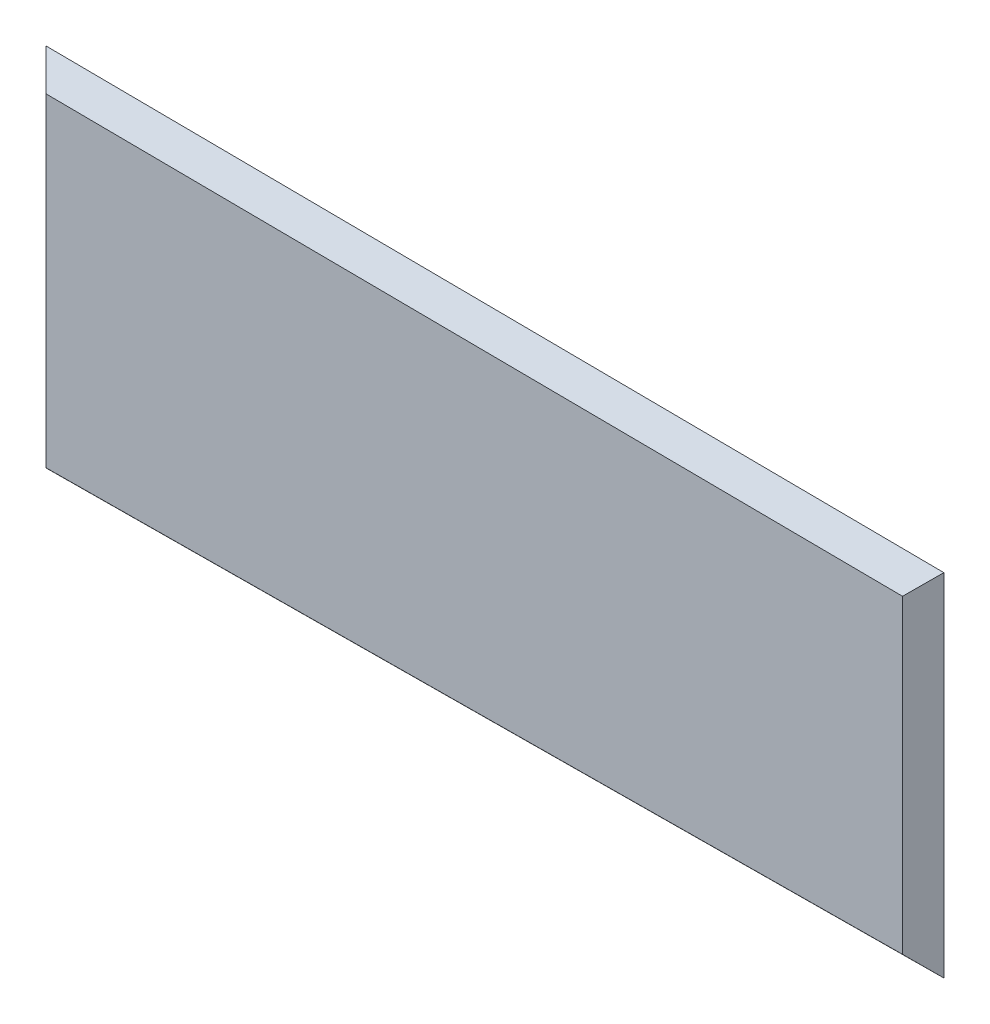
from build123d import *

# Parameters (mm, degrees)
AUFSATZ_LINEAR_AUSTRAGEN1_DEPTH = 10
FASE1_SIZE                      = 10


with BuildPart() as part:
    # Skizze1 → Aufsatz-Linear austragen1 (new body)
    with BuildSketch(Plane.XY):
        Polygon((-434.714346895, -88.5), (-434.714346895, 88.5), (0, 85), (0, -85), align=None)
    extrude(amount=AUFSATZ_LINEAR_AUSTRAGEN1_DEPTH)

    # Fase1
    fase1_edges = [part.edges().sort_by_distance(p)[0] for p in [
        (-434.714346895, 0, 10),
        (-217.357173448, 86.75, 10),
        (0, 0, 10),
        (-217.357173448, -86.75, 10),
    ]]
    chamfer(fase1_edges, length=FASE1_SIZE - 0.0001)  # a hair under: the kernel refuses the full size


solid = part.part
